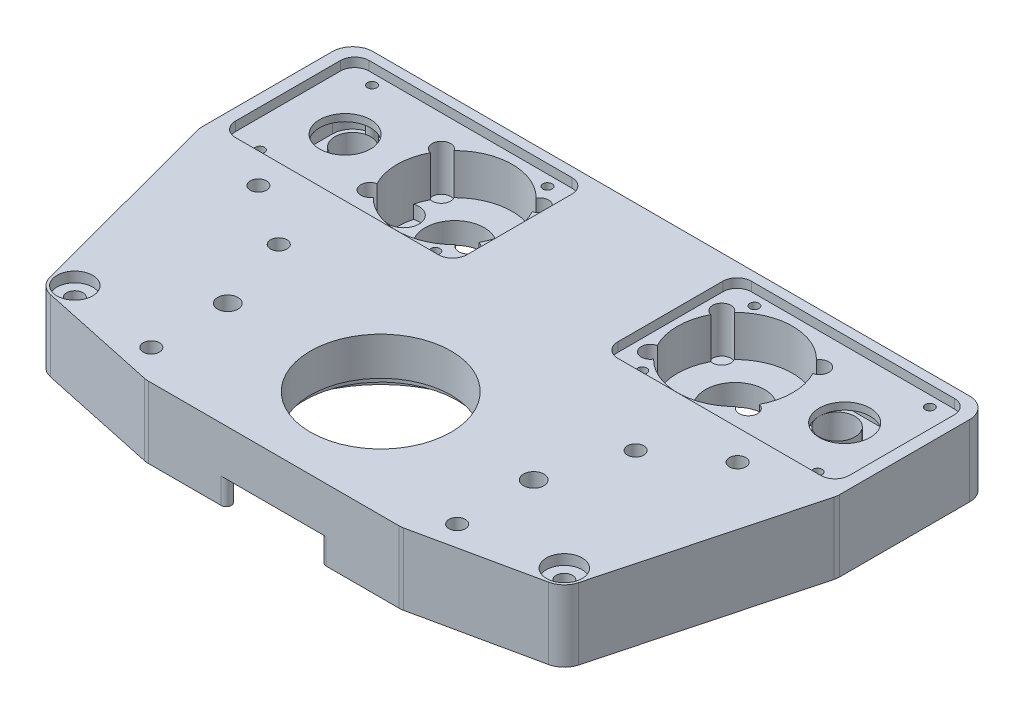
from build123d import *

# Parameters (mm, degrees)
SKETCH1_R             = 7.366
SKETCH1_R_2           = 11.176
SKETCH1_R_3           = 17.526
SKETCH1_R_4           = 2.032
BOSS_EXTRUDE1_DEPTH   = 17.78
CUT_EXTRUDE4_DEPTH    = 6.35
SKETCH2_R             = 19.05
SKETCH2_R_2           = 12.7
CUT_EXTRUDE3_DEPTH    = 1.905
CAVITY1_START         = 5.334
CAVITY1_OUTLINE_R     = 1.143
CAVITY1_OUTLINE_R_2   = 7.366
CAVITY1_OUTLINE_R_3   = 4.445
CAVITY1_DEPTH         = 12.446
CAVITY1_START_2       = 15.494
CAVITY1_2_OUTLINE_R   = 1.143
CAVITY1_2_OUTLINE_R_2 = 4.445
CAVITY1_2_DEPTH       = 2.286
CAVITY1_START_3       = 2.286
CAVITY1_3_OUTLINE_R   = 1.143
CAVITY1_3_OUTLINE_R_2 = 4.445
CAVITY1_3_DEPTH       = 3.048
CAVITY1_4_OUTLINE_R   = 1.905
CAVITY1_4_DEPTH       = 3.302
CAVITY1_START_4       = 13.716
CAVITY1_5_DEPTH       = 1.778
CAVITY1_START_5       = 4.064
CAVITY1_6_OUTLINE_R   = 2.286
CAVITY1_6_DEPTH       = 1.27
CAVITY1_START_6       = 2.032
CAVITY1_7_DEPTH       = 0.254
BOSS_EXTRUDE2_START   = -1.27
SKETCH4_R             = 11.176
BOSS_EXTRUDE2_DEPTH   = 1.27
FILLET1_R             = 5.08
SKETCH7_R             = 4.445
CUT_EXTRUDE7_DEPTH    = 2.54
SKETCH5_W             = 6.604
SKETCH5_H             = 6.604
CUT_EXTRUDE5_DEPTH    = 6.35
CUT_EXTRUDE8_DEPTH    = 2.54
CUT_EXTRUDE6_DEPTH    = 5.08
FILLET2_R             = 1.27
SKETCH10_R            = 2.54
CUT_EXTRUDE12_DEPTH   = 8.89


# Read off the part's stored shape, not the designer's step: Cavity1
with BuildPart() as part:
    # Sketch1 → Boss-Extrude1 (new body)
    with BuildSketch(Plane(origin=(0, 0, 0), x_dir=(1, 0, 0), z_dir=(0, 1, 0))):
        with BuildLine():
            Line((-79.375, 34.29), (79.375, 34.29))
            Line((79.375, 34.29), (79.375, -3.81))
            Line((79.375, -3.81), (65.869686106, -54.644370475))
            ThreePointArc((65.869686106, -54.644370475), (64.462367392, -57.019649801), (62.020546078, -58.308062199))
            Line((62.020546078, -58.308062199), (31.75, -64.77))
            Line((31.75, -64.77), (-31.75, -64.77))
            Line((-31.75, -64.77), (-62.020546078, -58.308062199))
            ThreePointArc((-62.020546078, -58.308062199), (-64.462367392, -57.019649801), (-65.869686106, -54.644370475))
            Line((-65.869686106, -54.644370475), (-79.375, -3.81))
            Line((-79.375, -3.81), (-79.375, 34.29))
        make_face()
        with Locations(Location((-34.919226796, 15.24, 0), (0, 0, 270))):
            Circle(SKETCH1_R, mode=Mode.SUBTRACT)
        with Locations(Location((0, 0, 0), (0, 0, 270))):
            Circle(SKETCH1_R_2, mode=Mode.SUBTRACT)
        with Locations(Location((0, -38.1, 0), (0, 0, 270))):
            Circle(SKETCH1_R_3, mode=Mode.SUBTRACT)
        with Locations(Location((34.919226796, 15.24, 0), (0, 0, 90))):
            Circle(SKETCH1_R, mode=Mode.SUBTRACT)
        with Locations(Location((-38.1, -57.15, 0), (0, 0, 270))):
            Circle(SKETCH1_R_4, mode=Mode.SUBTRACT)
        with Locations(Location((-44.45, -19.05, 0), (0, 0, 270))):
            Circle(SKETCH1_R_4, mode=Mode.SUBTRACT)
        with Locations(Location((38.1, -57.15, 0), (0, 0, 90))):
            Circle(SKETCH1_R_4, mode=Mode.SUBTRACT)
        with Locations(Location((44.45, -19.05, 0), (0, 0, 90))):
            Circle(SKETCH1_R_4, mode=Mode.SUBTRACT)
        with Locations(Location((60.96, -53.34, 0), (0, 0, 270))):
            Circle(SKETCH1_R_4, mode=Mode.SUBTRACT)
        with Locations(Location((-60.96, -53.34, 0), (0, 0, 90))):
            Circle(SKETCH1_R_4, mode=Mode.SUBTRACT)
        with Locations(Location((59.69, -8.89, 0), (0, 0, 270))):
            Circle(SKETCH1_R_4, mode=Mode.SUBTRACT)
        with Locations(Location((-59.69, -8.89, 0), (0, 0, 90))):
            Circle(SKETCH1_R_4, mode=Mode.SUBTRACT)
    extrude(amount=BOSS_EXTRUDE1_DEPTH)

    # Sketch3 → Cut-Extrude4 (cut)
    with BuildSketch(Plane.XZ):
        with BuildLine():
            ThreePointArc((9.692022286, 12.573), (0, 65.405), (-9.692022286, 12.573))
            ThreePointArc((-9.692022286, 12.573), (0, -15.875), (9.692022286, 12.573))
        make_face()
    extrude(amount=-CUT_EXTRUDE4_DEPTH, mode=Mode.SUBTRACT)

    # Sketch2 → Cut-Extrude3 (cut)
    with BuildSketch(Plane(origin=(0, 6.35, 0), x_dir=(-1, 0, 0), z_dir=(0, -1, 0))):
        with Locations(Location((0, -38.1, 0), (0, 0, 90))):
            Circle(SKETCH2_R)
        with Locations(Location((0, 0, 0), (0, 0, 90))):
            Circle(SKETCH2_R_2)
    extrude(amount=-CUT_EXTRUDE3_DEPTH, mode=Mode.SUBTRACT)

    # Cavity1 outline → Cavity1 (cut)
    # profile 1 of 12: a face of its own
    with BuildSketch(Plane(origin=(0, 0, 0), x_dir=(1, 0, 0), z_dir=(0, 1, 0)).offset(CAVITY1_START)):
        with Locations((25.775226796, 1.27)):
            Circle(CAVITY1_OUTLINE_R)
    # profile 2 of 12: a face of its own
    with BuildSketch(Plane(origin=(0, 0, 0), x_dir=(1, 0, 0), z_dir=(0, 1, 0)).offset(CAVITY1_START)):
        with BuildLine():
            ThreePointArc((24.688659292, 5.175871148), (34.919226795, 0.889), (45.149794299, 5.175871148))
            ThreePointArc((45.149794299, 5.175871148), (48.95833201, 5.003152448), (47.629415314, 8.576494253))
            ThreePointArc((47.629415314, 8.576494253), (49.270226796, 15.24), (47.629415314, 21.903505747))
            ThreePointArc((47.629415314, 21.903505747), (48.95833201, 25.476847552), (45.149794299, 25.304128852))
            ThreePointArc((45.149794299, 25.304128852), (34.919226796, 29.591), (24.688659292, 25.304128852))
            ThreePointArc((24.688659292, 25.304128852), (20.880121582, 25.476847552), (22.209038278, 21.903505747))
            ThreePointArc((22.209038278, 21.903505747), (20.568226796, 15.24), (22.209038278, 8.576494253))
            ThreePointArc((22.209038278, 8.576494253), (20.880121582, 5.003152448), (24.688659292, 5.175871148))
        make_face()
        with Locations((34.919226796, 15.24)):
            Circle(CAVITY1_OUTLINE_R_2, mode=Mode.SUBTRACT)
    # profile 3 of 12: a face of its own
    with BuildSketch(Plane(origin=(0, 0, 0), x_dir=(1, 0, 0), z_dir=(0, 1, 0)).offset(CAVITY1_START)):
        with Locations((69.463226796, 1.27)):
            Circle(CAVITY1_OUTLINE_R)
    # profile 4 of 12: a face of its own
    with BuildSketch(Plane(origin=(0, 0, 0), x_dir=(1, 0, 0), z_dir=(0, 1, 0)).offset(CAVITY1_START)):
        with Locations((60.319226796, 15.24)):
            Circle(CAVITY1_OUTLINE_R_3)
    # profile 5 of 12: a face of its own
    with BuildSketch(Plane(origin=(0, 0, 0), x_dir=(1, 0, 0), z_dir=(0, 1, 0)).offset(CAVITY1_START)):
        with BuildLine():
            ThreePointArc((-24.688659292, 25.304128852), (-34.919226796, 29.591), (-45.149794299, 25.304128852))
            ThreePointArc((-45.149794299, 25.304128852), (-48.95833201, 25.476847552), (-47.629415314, 21.903505747))
            ThreePointArc((-47.629415314, 21.903505747), (-49.270226796, 15.24), (-47.629415314, 8.576494253))
            ThreePointArc((-47.629415314, 8.576494253), (-48.95833201, 5.003152448), (-45.149794299, 5.175871148))
            ThreePointArc((-45.149794299, 5.175871148), (-34.919226796, 0.889), (-24.688659292, 5.175871148))
            ThreePointArc((-24.688659292, 5.175871148), (-20.880121582, 5.003152448), (-22.209038278, 8.576494253))
            ThreePointArc((-22.209038278, 8.576494253), (-20.568226796, 15.24), (-22.209038278, 21.903505747))
            ThreePointArc((-22.209038278, 21.903505747), (-20.880121582, 25.476847552), (-24.688659292, 25.304128852))
        make_face()
        with Locations((-34.919226796, 15.24)):
            Circle(CAVITY1_OUTLINE_R_2, mode=Mode.SUBTRACT)
    # profile 6 of 12: a face of its own
    with BuildSketch(Plane(origin=(0, 0, 0), x_dir=(1, 0, 0), z_dir=(0, 1, 0)).offset(CAVITY1_START)):
        with Locations((25.775226796, 29.21)):
            Circle(CAVITY1_OUTLINE_R)
    # profile 7 of 12: a face of its own
    with BuildSketch(Plane(origin=(0, 0, 0), x_dir=(1, 0, 0), z_dir=(0, 1, 0)).offset(CAVITY1_START)):
        with Locations((-25.775226796, 1.27)):
            Circle(CAVITY1_OUTLINE_R)
    # profile 8 of 12: a face of its own
    with BuildSketch(Plane(origin=(0, 0, 0), x_dir=(1, 0, 0), z_dir=(0, 1, 0)).offset(CAVITY1_START)):
        with Locations((-25.775226796, 29.21)):
            Circle(CAVITY1_OUTLINE_R)
    # profile 9 of 12: a face of its own
    with BuildSketch(Plane(origin=(0, 0, 0), x_dir=(1, 0, 0), z_dir=(0, 1, 0)).offset(CAVITY1_START)):
        with Locations((-69.463226796, 1.27)):
            Circle(CAVITY1_OUTLINE_R)
    # profile 10 of 12: a face of its own
    with BuildSketch(Plane(origin=(0, 0, 0), x_dir=(1, 0, 0), z_dir=(0, 1, 0)).offset(CAVITY1_START)):
        with Locations((69.463226796, 29.21)):
            Circle(CAVITY1_OUTLINE_R)
    # profile 11 of 12: a face of its own
    with BuildSketch(Plane(origin=(0, 0, 0), x_dir=(1, 0, 0), z_dir=(0, 1, 0)).offset(CAVITY1_START)):
        with Locations((-69.463226796, 29.21)):
            Circle(CAVITY1_OUTLINE_R)
    # profile 12 of 12: a face of its own
    with BuildSketch(Plane(origin=(0, 0, 0), x_dir=(1, 0, 0), z_dir=(0, 1, 0)).offset(CAVITY1_START)):
        with Locations((-60.319226796, 15.24)):
            Circle(CAVITY1_OUTLINE_R_3)
    extrude(amount=CAVITY1_DEPTH, mode=Mode.SUBTRACT)

    # Cavity1 2 outline → Cavity1 2 (cut)
    # profile 1 of 2: a face of its own
    with BuildSketch(Plane(origin=(0, 0, 0), x_dir=(1, 0, 0), z_dir=(0, 1, 0)).offset(CAVITY1_START_2)):
        with BuildLine():
            ThreePointArc((72.892226796, -1.397), (75.40669851, -0.355471713), (76.448226796, 2.159))
            Line((76.448226796, 2.159), (76.448226796, 28.321))
            ThreePointArc((76.448226796, 28.321), (75.40669851, 30.835471713), (72.892226796, 31.877))
            Line((72.892226796, 31.877), (22.346226796, 31.877))
            ThreePointArc((22.346226796, 31.877), (19.831755082, 30.835471714), (18.790226796, 28.321))
            Line((18.790226796, 28.321), (18.790226796, 2.159))
            ThreePointArc((18.790226796, 2.159), (19.831755082, -0.355471714), (22.346226796, -1.397))
            Line((22.346226796, -1.397), (72.892226796, -1.397))
        make_face()
        with Locations((25.775226796, 1.27)):
            Circle(CAVITY1_2_OUTLINE_R, mode=Mode.SUBTRACT)
        with BuildLine():
            ThreePointArc((24.688659292, 5.175871148), (20.880121582, 5.003152448), (22.209038278, 8.576494253))
            ThreePointArc((22.209038278, 8.576494253), (20.568226796, 15.24), (22.209038278, 21.903505747))
            ThreePointArc((22.209038278, 21.903505747), (20.880121582, 25.476847552), (24.688659292, 25.304128852))
            ThreePointArc((24.688659292, 25.304128852), (34.919226796, 29.591), (45.149794299, 25.304128852))
            ThreePointArc((45.149794299, 25.304128852), (48.95833201, 25.476847552), (47.629415314, 21.903505747))
            ThreePointArc((47.629415314, 21.903505747), (49.270226796, 15.24), (47.629415314, 8.576494253))
            ThreePointArc((47.629415314, 8.576494253), (48.95833201, 5.003152448), (45.149794299, 5.175871148))
            ThreePointArc((45.149794299, 5.175871148), (34.919226795, 0.889), (24.688659292, 5.175871148))
        make_face(mode=Mode.SUBTRACT)
        with Locations((60.319226796, 15.24)):
            Circle(CAVITY1_2_OUTLINE_R_2, mode=Mode.SUBTRACT)
        with Locations((69.463226796, 1.27)):
            Circle(CAVITY1_2_OUTLINE_R, mode=Mode.SUBTRACT)
        with Locations((25.775226796, 29.21)):
            Circle(CAVITY1_2_OUTLINE_R, mode=Mode.SUBTRACT)
        with Locations((69.463226796, 29.21)):
            Circle(CAVITY1_2_OUTLINE_R, mode=Mode.SUBTRACT)
    # profile 2 of 2: a face of its own
    with BuildSketch(Plane(origin=(0, 0, 0), x_dir=(1, 0, 0), z_dir=(0, 1, 0)).offset(CAVITY1_START_2)):
        with BuildLine():
            Line((-22.346226796, 31.877), (-72.892226796, 31.877))
            ThreePointArc((-72.892226796, 31.877), (-75.40669851, 30.835471713), (-76.448226796, 28.321))
            Line((-76.448226796, 28.321), (-76.448226796, 2.159))
            ThreePointArc((-76.448226796, 2.159), (-75.40669851, -0.355471713), (-72.892226796, -1.397))
            Line((-72.892226796, -1.397), (-22.346226796, -1.397))
            ThreePointArc((-22.346226796, -1.397), (-19.831755082, -0.355471714), (-18.790226796, 2.159))
            Line((-18.790226796, 2.159), (-18.790226796, 28.321))
            ThreePointArc((-18.790226796, 28.321), (-19.831755082, 30.835471714), (-22.346226796, 31.877))
        make_face()
        with BuildLine():
            ThreePointArc((-22.209038278, 21.903505747), (-20.568226796, 15.24), (-22.209038278, 8.576494253))
            ThreePointArc((-22.209038278, 8.576494253), (-20.880121582, 5.003152448), (-24.688659292, 5.175871148))
            ThreePointArc((-24.688659292, 5.175871148), (-34.919226796, 0.889), (-45.149794299, 5.175871148))
            ThreePointArc((-45.149794299, 5.175871148), (-48.95833201, 5.003152448), (-47.629415314, 8.576494253))
            ThreePointArc((-47.629415314, 8.576494253), (-49.270226796, 15.24), (-47.629415314, 21.903505747))
            ThreePointArc((-47.629415314, 21.903505747), (-48.95833201, 25.476847552), (-45.149794299, 25.304128852))
            ThreePointArc((-45.149794299, 25.304128852), (-34.919226796, 29.591), (-24.688659292, 25.304128852))
            ThreePointArc((-24.688659292, 25.304128852), (-20.880121582, 25.476847552), (-22.209038278, 21.903505747))
        make_face(mode=Mode.SUBTRACT)
        with Locations((-25.775226796, 29.21)):
            Circle(CAVITY1_2_OUTLINE_R, mode=Mode.SUBTRACT)
        with Locations((-25.775226796, 1.27)):
            Circle(CAVITY1_2_OUTLINE_R, mode=Mode.SUBTRACT)
        with Locations((-60.319226796, 15.24)):
            Circle(CAVITY1_2_OUTLINE_R_2, mode=Mode.SUBTRACT)
        with Locations((-69.463226796, 29.21)):
            Circle(CAVITY1_2_OUTLINE_R, mode=Mode.SUBTRACT)
        with Locations((-69.463226796, 1.27)):
            Circle(CAVITY1_2_OUTLINE_R, mode=Mode.SUBTRACT)
    extrude(amount=CAVITY1_2_DEPTH, mode=Mode.SUBTRACT)

    # Cavity1 3 outline → Cavity1 3 (cut)
    with BuildSketch(Plane(origin=(0, 0, 0), x_dir=(1, 0, 0), z_dir=(0, 1, 0)).offset(CAVITY1_START_3)):
        with Locations((25.775226796, 1.27)):
            Circle(CAVITY1_3_OUTLINE_R)
        with BuildLine():
            ThreePointArc((48.806041796, 18.86043784), (43.809226796, 15.24), (48.806041796, 11.61956216))
            ThreePointArc((48.806041796, 11.61956216), (49.270226796, 15.24), (48.806041796, 18.86043784))
        make_face()
        with Locations((69.463226796, 1.27)):
            Circle(CAVITY1_3_OUTLINE_R)
        with Locations((60.319226796, 15.24)):
            Circle(CAVITY1_3_OUTLINE_R_2)
        with Locations((25.775226796, 29.21)):
            Circle(CAVITY1_3_OUTLINE_R)
        with Locations((-25.775226796, 1.27)):
            Circle(CAVITY1_3_OUTLINE_R)
        with Locations((-25.775226796, 29.21)):
            Circle(CAVITY1_3_OUTLINE_R)
        with Locations((-69.463226796, 1.27)):
            Circle(CAVITY1_3_OUTLINE_R)
        with Locations((69.463226796, 29.21)):
            Circle(CAVITY1_3_OUTLINE_R)
        with BuildLine():
            ThreePointArc((-48.806041796, 18.86043784), (-49.270226796, 15.24), (-48.806041796, 11.61956216))
            ThreePointArc((-48.806041796, 11.61956216), (-43.809226796, 15.24), (-48.806041796, 18.86043784))
        make_face()
        with Locations((-69.463226796, 29.21)):
            Circle(CAVITY1_3_OUTLINE_R)
        with Locations((-60.319226796, 15.24)):
            Circle(CAVITY1_3_OUTLINE_R_2)
    extrude(amount=CAVITY1_3_DEPTH, mode=Mode.SUBTRACT)

    # Cavity1 4 outline → Cavity1 4 (cut)
    with BuildSketch(Plane(origin=(0, 0, 0), x_dir=(1, 0, 0), z_dir=(0, 1, 0))):
        with Locations((25.775226796, 1.27)):
            Circle(CAVITY1_4_OUTLINE_R)
        with Locations((69.463226796, 1.27)):
            Circle(CAVITY1_4_OUTLINE_R)
        with Locations((25.775226796, 29.21)):
            Circle(CAVITY1_4_OUTLINE_R)
        with Locations((-25.775226796, 1.27)):
            Circle(CAVITY1_4_OUTLINE_R)
        with Locations((-25.775226796, 29.21)):
            Circle(CAVITY1_4_OUTLINE_R)
        with Locations((-69.463226796, 1.27)):
            Circle(CAVITY1_4_OUTLINE_R)
        with Locations((69.463226796, 29.21)):
            Circle(CAVITY1_4_OUTLINE_R)
        with Locations((-69.463226796, 29.21)):
            Circle(CAVITY1_4_OUTLINE_R)
    extrude(amount=CAVITY1_4_DEPTH, mode=Mode.SUBTRACT)

    # Cavity1 5 outline → Cavity1 5 (cut)
    with BuildSketch(Plane(origin=(0, 0, 0), x_dir=(1, 0, 0), z_dir=(0, 1, 0)).offset(CAVITY1_START_4)):
        with BuildLine():
            Line((59.308285461, 10.911487251), (61.21795276, 8.970238237))
            ThreePointArc((61.21795276, 8.970238237), (65.207576572, 9.634455948), (67.986896437, 12.572765737))
            Line((67.986896437, 12.572765737), (64.495295738, 13.71734666))
            ThreePointArc((64.495295738, 13.71734666), (62.434107395, 11.330357427), (59.308285461, 10.911487251))
        make_face()
        with BuildLine():
            ThreePointArc((56.000875132, 13.978099029), (57.826893585, 10.658956382), (61.21795276, 8.970238237))
            Line((61.21795276, 8.970238237), (59.308285461, 10.911487251))
            ThreePointArc((59.308285461, 10.911487251), (57.262889291, 12.012489186), (56.052168703, 13.994913564))
            Line((56.052168703, 13.994913564), (56.000875132, 13.978099029))
        make_face()
        with BuildLine():
            ThreePointArc((55.938804378, 14.336692172), (55.967270306, 14.156950841), (56.000875132, 13.978099029))
            Line((56.000875132, 13.978099029), (56.052168703, 13.994913564))
            ThreePointArc((56.052168703, 13.994913564), (56.010737642, 14.146864047), (55.974715733, 14.300186923))
            Line((55.974715733, 14.300186923), (55.938804378, 14.336692172))
        make_face()
        with BuildLine():
            Line((64.495295738, 13.71734666), (67.986896437, 12.572765737))
            ThreePointArc((67.986896437, 12.572765737), (68.425656156, 13.874432759), (68.574226796, 15.24))
            ThreePointArc((68.574226796, 15.24), (68.425656156, 16.605567241), (67.986896437, 17.907234263))
            Line((67.986896437, 17.907234263), (64.495295738, 16.76265334))
            ThreePointArc((64.495295738, 16.76265334), (64.696477728, 16.013110132), (64.764226796, 15.24))
            ThreePointArc((64.764226796, 15.24), (64.696477728, 14.466889868), (64.495295738, 13.71734666))
        make_face()
        with BuildLine():
            Line((55.974715733, 16.179813077), (55.938804378, 16.143307828))
            ThreePointArc((55.938804378, 16.143307828), (55.890391767, 15.692806608), (55.874226796, 15.24))
            ThreePointArc((55.874226796, 15.24), (55.899420427, 15.712585084), (55.974715733, 16.179813077))
        make_face()
        with BuildLine():
            ThreePointArc((56.000875132, 16.501900971), (55.967270306, 16.323049159), (55.938804378, 16.143307828))
            Line((55.938804378, 16.143307828), (55.974715733, 16.179813077))
            ThreePointArc((55.974715733, 16.179813077), (56.010737642, 16.333135953), (56.052168703, 16.485086436))
            Line((56.052168703, 16.485086436), (56.000875132, 16.501900971))
        make_face()
        with BuildLine():
            ThreePointArc((55.874226796, 15.24), (55.890391767, 14.787193392), (55.938804378, 14.336692172))
            Line((55.938804378, 14.336692172), (55.974715733, 14.300186923))
            ThreePointArc((55.974715733, 14.300186923), (55.899420427, 14.767414916), (55.874226796, 15.24))
        make_face()
        with BuildLine():
            ThreePointArc((61.21795276, 21.509761763), (57.826893585, 19.821043618), (56.000875132, 16.501900971))
            Line((56.000875132, 16.501900971), (56.052168703, 16.485086436))
            ThreePointArc((56.052168703, 16.485086436), (57.262889291, 18.467510814), (59.308285461, 19.568512749))
            Line((59.308285461, 19.568512749), (61.21795276, 21.509761763))
        make_face()
        with BuildLine():
            Line((64.495295738, 16.76265334), (67.986896437, 17.907234263))
            ThreePointArc((67.986896437, 17.907234263), (65.207576572, 20.845544052), (61.21795276, 21.509761763))
            Line((61.21795276, 21.509761763), (59.308285461, 19.568512749))
            ThreePointArc((59.308285461, 19.568512749), (62.434107395, 19.149642573), (64.495295738, 16.76265334))
        make_face()
        with BuildLine():
            Line((-59.308285461, 10.911487251), (-61.21795276, 8.970238237))
            ThreePointArc((-61.21795276, 8.970238237), (-57.826893585, 10.658956382), (-56.000875132, 13.978099029))
            Line((-56.000875132, 13.978099029), (-56.052168703, 13.994913564))
            ThreePointArc((-56.052168703, 13.994913564), (-57.262889291, 12.012489186), (-59.308285461, 10.911487251))
        make_face()
        with BuildLine():
            ThreePointArc((-67.986896437, 12.572765737), (-65.207576572, 9.634455948), (-61.21795276, 8.970238237))
            Line((-61.21795276, 8.970238237), (-59.308285461, 10.911487251))
            ThreePointArc((-59.308285461, 10.911487251), (-62.434107395, 11.330357427), (-64.495295738, 13.71734666))
            Line((-64.495295738, 13.71734666), (-67.986896437, 12.572765737))
        make_face()
        with BuildLine():
            Line((-56.052168703, 13.994913564), (-56.000875132, 13.978099029))
            ThreePointArc((-56.000875132, 13.978099029), (-55.967270306, 14.156950841), (-55.938804378, 14.336692172))
            Line((-55.938804378, 14.336692172), (-55.974715733, 14.300186923))
            ThreePointArc((-55.974715733, 14.300186923), (-56.010737642, 14.146864047), (-56.052168703, 13.994913564))
        make_face()
        with BuildLine():
            ThreePointArc((-67.986896437, 17.907234263), (-68.574226796, 15.24), (-67.986896437, 12.572765737))
            Line((-67.986896437, 12.572765737), (-64.495295738, 13.71734666))
            ThreePointArc((-64.495295738, 13.71734666), (-64.764226796, 15.24), (-64.495295738, 16.76265334))
            Line((-64.495295738, 16.76265334), (-67.986896437, 17.907234263))
        make_face()
        with BuildLine():
            Line((-55.974715733, 14.300186923), (-55.938804378, 14.336692172))
            ThreePointArc((-55.938804378, 14.336692172), (-55.890391767, 14.787193392), (-55.874226796, 15.24))
            ThreePointArc((-55.874226796, 15.24), (-55.899420427, 14.767414916), (-55.974715733, 14.300186923))
        make_face()
        with BuildLine():
            Line((-55.974715733, 16.179813077), (-55.938804378, 16.143307828))
            ThreePointArc((-55.938804378, 16.143307828), (-55.967270306, 16.323049159), (-56.000875132, 16.501900971))
            Line((-56.000875132, 16.501900971), (-56.052168703, 16.485086436))
            ThreePointArc((-56.052168703, 16.485086436), (-56.010737642, 16.333135953), (-55.974715733, 16.179813077))
        make_face()
        with BuildLine():
            ThreePointArc((-55.874226796, 15.24), (-55.890391767, 15.692806608), (-55.938804378, 16.143307828))
            Line((-55.938804378, 16.143307828), (-55.974715733, 16.179813077))
            ThreePointArc((-55.974715733, 16.179813077), (-55.899420427, 15.712585084), (-55.874226796, 15.24))
        make_face()
        with BuildLine():
            ThreePointArc((-61.21795276, 21.509761763), (-65.207576572, 20.845544052), (-67.986896437, 17.907234263))
            Line((-67.986896437, 17.907234263), (-64.495295738, 16.76265334))
            ThreePointArc((-64.495295738, 16.76265334), (-62.434107395, 19.149642573), (-59.308285461, 19.568512749))
            Line((-59.308285461, 19.568512749), (-61.21795276, 21.509761763))
        make_face()
        with BuildLine():
            ThreePointArc((-56.000875132, 16.501900971), (-57.826893585, 19.821043618), (-61.21795276, 21.509761763))
            Line((-61.21795276, 21.509761763), (-59.308285461, 19.568512749))
            ThreePointArc((-59.308285461, 19.568512749), (-57.262889291, 18.467510814), (-56.052168703, 16.485086436))
            Line((-56.052168703, 16.485086436), (-56.000875132, 16.501900971))
        make_face()
    extrude(amount=CAVITY1_5_DEPTH, mode=Mode.SUBTRACT)

    # Cavity1 6 outline → Cavity1 6 (cut)
    with BuildSketch(Plane(origin=(0, 0, 0), x_dir=(1, 0, 0), z_dir=(0, 1, 0)).offset(CAVITY1_START_5)):
        with Locations((22.727226796, 6.35)):
            Circle(CAVITY1_6_OUTLINE_R)
        with Locations((47.111226796, 6.35)):
            Circle(CAVITY1_6_OUTLINE_R)
        with Locations((22.727226796, 24.13)):
            Circle(CAVITY1_6_OUTLINE_R)
        with Locations((47.111226796, 24.13)):
            Circle(CAVITY1_6_OUTLINE_R)
        with Locations((-22.727226796, 24.13)):
            Circle(CAVITY1_6_OUTLINE_R)
        with Locations((-22.727226796, 6.35)):
            Circle(CAVITY1_6_OUTLINE_R)
        with Locations((-47.111226796, 6.35)):
            Circle(CAVITY1_6_OUTLINE_R)
        with Locations((-47.111226796, 24.13)):
            Circle(CAVITY1_6_OUTLINE_R)
    extrude(amount=CAVITY1_6_DEPTH, mode=Mode.SUBTRACT)

    # Cavity1 7 outline → Cavity1 7 (cut)
    with BuildSketch(Plane(origin=(0, 0, 0), x_dir=(1, 0, 0), z_dir=(0, 1, 0)).offset(CAVITY1_START_6)):
        with BuildLine():
            ThreePointArc((48.806041796, 18.86043784), (43.809226796, 15.24), (48.806041796, 11.61956216))
            ThreePointArc((48.806041796, 11.61956216), (49.270226796, 15.24), (48.806041796, 18.86043784))
        make_face()
        with BuildLine():
            ThreePointArc((-48.806041796, 18.86043784), (-49.270226796, 15.24), (-48.806041796, 11.61956216))
            ThreePointArc((-48.806041796, 11.61956216), (-43.809226796, 15.24), (-48.806041796, 18.86043784))
        make_face()
    extrude(amount=CAVITY1_7_DEPTH, mode=Mode.SUBTRACT)

    # Sketch4 → Boss-Extrude2 (add)
    with BuildSketch(Plane(origin=(0, 17.78, 0), x_dir=(1, 0, 0), z_dir=(0, 1, 0)).offset(BOSS_EXTRUDE2_START)):
        with Locations(Location((0, 0, 0), (0, 0, 90))):
            Circle(SKETCH4_R)
    extrude(amount=BOSS_EXTRUDE2_DEPTH)

    # Fillet1
    fillet1_edges = [part.edges().sort_by_distance(p)[0] for p in [
        (-79.375, 8.89, 3.81),
        (-79.375, 8.89, -34.29),
        (79.375, 8.89, -34.29),
        (79.375, 8.89, 3.81),
        (31.75, 8.89, 64.77),
        (-31.75, 8.89, 64.77),
    ]]
    fillet(fillet1_edges, radius=FILLET1_R)

    # Sketch7 → Cut-Extrude7 (cut)
    with BuildSketch(Plane(origin=(0, 17.78, 0), x_dir=(1, 0, 0), z_dir=(0, 1, 0))):
        with Locations(Location((60.96, -53.34, 0), (0, 0, 270))):
            Circle(SKETCH7_R)
    cut_extrude7 = extrude(amount=-CUT_EXTRUDE7_DEPTH, mode=Mode.SUBTRACT)

    # Sketch5 → Cut-Extrude5 (cut)
    with BuildSketch(Plane.XZ):
        with Locations((38.1, 41.275)):
            Rectangle(SKETCH5_W, SKETCH5_H)
    cut_extrude5 = extrude(amount=-CUT_EXTRUDE5_DEPTH, mode=Mode.SUBTRACT)

    # Sketch8 → Cut-Extrude8 (cut)
    with BuildSketch(Plane(origin=(0, 0, 0), x_dir=(-1, 0, 0), z_dir=(0, -1, 0))):
        Polygon((-60.035255033, -57.03897987), (-57.294216981, -54.388637301), (-58.218961948, -50.689657431), (-61.884744967, -49.64102013), (-64.625783019, -52.291362699), (-63.701038052, -55.990342569), align=None)
        Polygon((-55.877178822, -8.89), (-57.783589411, -5.588), (-61.596410589, -5.588), (-63.502821178, -8.89), (-61.596410589, -12.192), (-57.783589411, -12.192), align=None)
    cut_extrude8 = extrude(amount=-CUT_EXTRUDE8_DEPTH, mode=Mode.SUBTRACT)

    # Sketch6 → Cut-Extrude6 (cut)
    with BuildSketch(Plane(origin=(0, 0, 0), x_dir=(1, 0, 0), z_dir=(0, 1, 0))):
        Polygon((-39.317356107, -19.05), (-41.883678053, -14.605), (-47.016321947, -14.605), (-49.582643893, -19.05), (-47.016321947, -23.495), (-41.883678053, -23.495), align=None)
        Polygon((-32.830193559, -57.466310089), (-35.191164207, -52.744368794), (-40.460970648, -52.428058704), (-43.369806441, -56.833689911), (-41.008835793, -61.555631206), (-35.739029352, -61.871941296), align=None)
        Polygon((35.739029352, -61.871941296), (32.830193559, -57.466310089), (35.191164207, -52.744368794), (40.460970648, -52.428058704), (43.369806441, -56.833689911), (41.008835793, -61.555631206), align=None)
        Polygon((41.883678053, -23.495), (39.317356107, -19.05), (41.883678053, -14.605), (47.016321947, -14.605), (49.582643893, -19.05), (47.016321947, -23.495), align=None)
    extrude(amount=CUT_EXTRUDE6_DEPTH, mode=Mode.SUBTRACT)

    # Fillet2
    fillet2_edges = [part.edges().sort_by_distance(p)[0] for p in [
        (-5.85441073, 3.175, 64.77),
        (5.85441073, 3.175, 64.77),
    ]]
    fillet(fillet2_edges, radius=FILLET2_R)

    # Sketch10 → Cut-Extrude12 (cut)
    with BuildSketch(Plane(origin=(0, 17.78, 0), x_dir=(1, 0, 0), z_dir=(0, 1, 0))):
        with Locations(Location((-38.1, -38.1, 0), (0, 0, 270))):
            Circle(SKETCH10_R)
    cut_extrude12 = extrude(amount=-CUT_EXTRUDE12_DEPTH, mode=Mode.SUBTRACT)

    # Mirror1: Cut-Extrude7, Cut-Extrude5, Cut-Extrude8, Cut-Extrude12 across plane
    add(cut_extrude7.mirror(Plane(origin=(0, 0, 0), x_dir=(0, 0, 1), z_dir=(1, 0, 0))), mode=Mode.SUBTRACT)
    add(cut_extrude5.mirror(Plane(origin=(0, 0, 0), x_dir=(0, 0, 1), z_dir=(1, 0, 0))), mode=Mode.SUBTRACT)
    add(cut_extrude8.mirror(Plane(origin=(0, 0, 0), x_dir=(0, 0, 1), z_dir=(1, 0, 0))), mode=Mode.SUBTRACT)
    add(cut_extrude12.mirror(Plane(origin=(0, 0, 0), x_dir=(0, 0, 1), z_dir=(1, 0, 0))), mode=Mode.SUBTRACT)


solid = part.part
